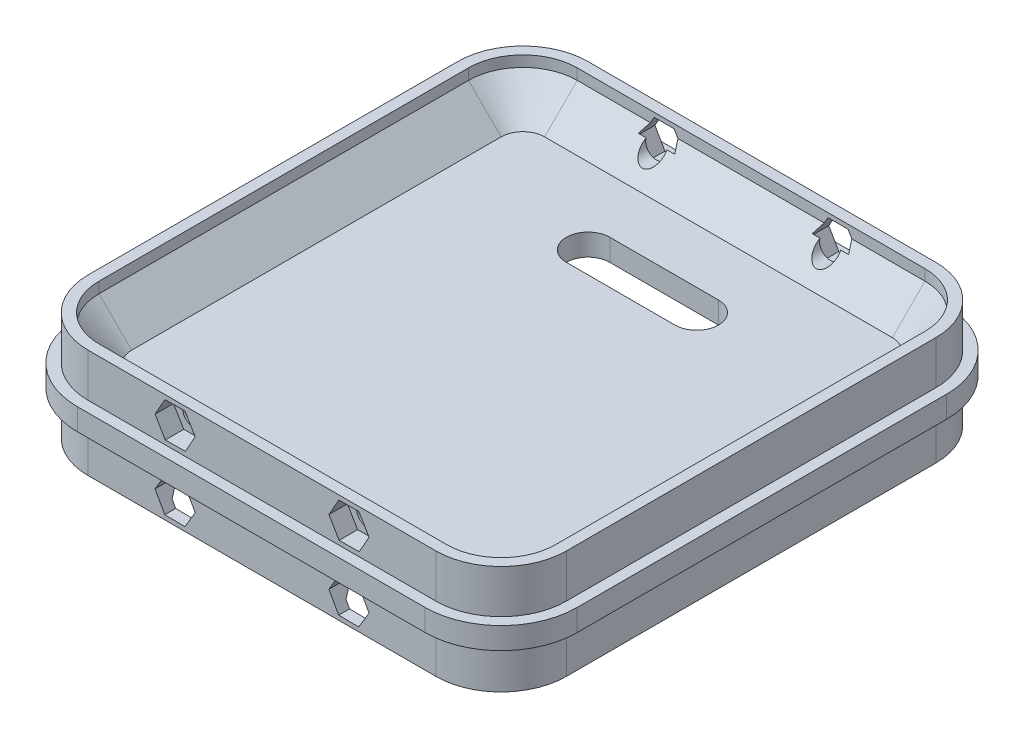
from build123d import *

# Parameters (mm, degrees)
BOSS_EXTRUDE1_DEPTH      = 30
BOSS_EXTRUDE1_DEPTH_BACK = 20
BOSS_EXTRUDE2_DEPTH      = 10
SKETCH2_R                = 5
CUT_EXTRUDE1_DEPTH       = 30
CUT_EXTRUDE3_START       = -30
SKETCH3_R                = 5
CUT_EXTRUDE3_DEPTH       = 30
CUT_EXTRUDE5_DEPTH       = 330.165611813
CUT_EXTRUDE7_DEPTH       = 20
CUT_EXTRUDE8_START       = -20
CUT_EXTRUDE8_DEPTH       = 20
CHAMFER7_SIZE            = 15
CUT_EXTRUDE6_DEPTH       = 8.5
SKETCH2_4_R              = 5
CUT_EXTRUDE2_DEPTH       = 8.5


with BuildPart() as part:
    # Sketch1 → Boss-Extrude1 (new, two sides: drawn at the far end of the back side and taken through both)
    with BuildSketch(Plane(origin=(0, 0, 0), x_dir=(1, 0, 0), z_dir=(0, 1, 0)).offset(-BOSS_EXTRUDE1_DEPTH_BACK)):
        with BuildLine():
            Line((30, 0), (190, 0))
            ThreePointArc((190, 0), (211.213203436, 8.786796564), (220, 30))
            Line((220, 30), (220, 200))
            ThreePointArc((220, 200), (211.213203436, 221.213203436), (190, 230))
            Line((190, 230), (30, 230))
            ThreePointArc((30, 230), (8.786796564, 221.213203436), (0, 200))
            Line((0, 200), (0, 30))
            ThreePointArc((0, 30), (8.786796564, 8.786796564), (30, 0))
        make_face()
    extrude(amount=BOSS_EXTRUDE1_DEPTH + BOSS_EXTRUDE1_DEPTH_BACK)

    # Sketch1<3> → Boss-Extrude2 (add)
    with BuildSketch(Plane(origin=(0, 0, 0), x_dir=(1, 0, 0), z_dir=(0, 1, 0))):
        with BuildLine():
            Line((-5, 30), (-5, 200))
            ThreePointArc((-5, 200), (5.251262658, 224.748737342), (30, 235))
            Line((30, 235), (190, 235))
            ThreePointArc((190, 235), (214.748737342, 224.748737342), (225, 200))
            Line((225, 200), (225, 30))
            ThreePointArc((225, 30), (214.748737342, 5.251262658), (190, -5))
            Line((190, -5), (30, -5))
            ThreePointArc((30, -5), (5.251262658, 5.251262658), (-5, 30))
        make_face()
        with BuildLine():
            Line((30, 0), (190, 0))
            ThreePointArc((190, 0), (211.213203436, 8.786796564), (220, 30))
            Line((220, 30), (220, 200))
            ThreePointArc((220, 200), (211.213203436, 221.213203436), (190, 230))
            Line((190, 230), (30, 230))
            ThreePointArc((30, 230), (8.786796564, 221.213203436), (0, 200))
            Line((0, 200), (0, 30))
            ThreePointArc((0, 30), (8.786796564, 8.786796564), (30, 0))
        make_face(mode=Mode.SUBTRACT)
    extrude(amount=BOSS_EXTRUDE2_DEPTH)

    # Sketch2 → Cut-Extrude1 (cut)
    with BuildSketch(Plane(origin=(0, 0, -230), x_dir=(-1, 0, 0), z_dir=(0, 0, -1))):
        with Locations((-150, 20)):
            Circle(SKETCH2_R)
        with Locations(Location((-70, 20, 0), (0, 0, 180))):
            Circle(SKETCH2_R)
        with Locations((-70, -10)):
            Circle(SKETCH2_R)
        with Locations(Location((-150, -10, 0), (0, 0, 180))):
            Circle(SKETCH2_R)
    extrude(amount=-CUT_EXTRUDE1_DEPTH, mode=Mode.SUBTRACT)

    # Sketch3 → Cut-Extrude3 (cut)
    with BuildSketch(Plane.XY.offset(CUT_EXTRUDE3_START)):
        with Locations((70, 20)):
            Circle(SKETCH3_R)
        with Locations(Location((150, 20, 0), (0, 0, 180))):
            Circle(SKETCH3_R)
        with Locations((150, -10)):
            Circle(SKETCH3_R)
        with Locations(Location((70, -10, 0), (0, 0, 180))):
            Circle(SKETCH3_R)
    extrude(amount=CUT_EXTRUDE3_DEPTH, mode=Mode.SUBTRACT)

    # Sketch4 → Cut-Extrude5 (cut, through all)
    with BuildSketch(Plane(origin=(0, 30, 0), x_dir=(1, 0, 0), z_dir=(0, 1, 0))):
        with BuildLine():
            Line((135, 165), (85, 165))
            ThreePointArc((85, 165), (75, 175), (85, 185))
            Line((85, 185), (135, 185))
            ThreePointArc((135, 185), (145, 175), (135, 165))
        make_face()
    extrude(amount=-CUT_EXTRUDE5_DEPTH, mode=Mode.SUBTRACT)

    # Sketch7 → Cut-Extrude7 (cut)
    with BuildSketch(Plane(origin=(0, 30, 0), x_dir=(1, 0, 0), z_dir=(0, 1, 0))):
        with BuildLine():
            Line((215, 30), (215, 200))
            ThreePointArc((215, 200), (207.67766953, 217.67766953), (190, 225))
            Line((190, 225), (30, 225))
            ThreePointArc((30, 225), (12.32233047, 217.67766953), (5, 200))
            Line((5, 200), (5, 30))
            ThreePointArc((5, 30), (12.32233047, 12.32233047), (30, 5))
            Line((30, 5), (190, 5))
            ThreePointArc((190, 5), (207.67766953, 12.32233047), (215, 30))
        make_face()
    extrude(amount=-CUT_EXTRUDE7_DEPTH, mode=Mode.SUBTRACT)

    # Sketch9 → Cut-Extrude8 (cut)
    with BuildSketch(Plane.XZ.offset(20).offset(CUT_EXTRUDE8_START)):
        with BuildLine():
            Line((190, -5), (30, -5))
            ThreePointArc((30, -5), (12.32233047, -12.32233047), (5, -30))
            Line((5, -30), (5, -200))
            ThreePointArc((5, -200), (12.32233047, -217.67766953), (30, -225))
            Line((30, -225), (190, -225))
            ThreePointArc((190, -225), (207.67766953, -217.67766953), (215, -200))
            Line((215, -200), (215, -30))
            ThreePointArc((215, -30), (207.67766953, -12.32233047), (190, -5))
        make_face()
    extrude(amount=CUT_EXTRUDE8_DEPTH, mode=Mode.SUBTRACT)

    # Chamfer7
    # the kernel refuses this chamfer: 15 mm, written as the material it adds along each edge
    with BuildSketch(Plane(origin=(190, 10, -225), x_dir=(0, 0.9996219169112968, -0.02749587661058586), z_dir=(-1, 0, 0))) as chamfer7_piece_1_section:
        Polygon((CHAMFER7_SIZE * 0.999621916911, -CHAMFER7_SIZE * 0.0274958766106), (-CHAMFER7_SIZE * 0.0274958766106, -CHAMFER7_SIZE * 0.999621916911), (0, 0), align=None)
    chamfer7_piece_1 = extrude(amount=160, mode=Mode.PRIVATE)
    chamfer7_piece_1 = chamfer7_piece_1 - Plane(origin=(150, 20, -219.960339284), x_dir=(-1, 0, 0), z_dir=(0, 0, -1)) * Cylinder(5, 380, mode=Mode.PRIVATE)
    chamfer7_piece_1 = chamfer7_piece_1 - Plane(origin=(70, 20, -219.960339284), x_dir=(1, 0, 0), z_dir=(0, 0, -1)) * Cylinder(5, 380, mode=Mode.PRIVATE)
    add(chamfer7_piece_1)
    with BuildSketch(Plane(origin=(30, 10, -5), x_dir=(0, 0.9996219169112968, 0.02749587661058638), z_dir=(1, 0, 0))) as chamfer7_piece_2_section:
        Polygon((CHAMFER7_SIZE * 0.999621916911, -CHAMFER7_SIZE * 0.0274958766106), (-CHAMFER7_SIZE * 0.0274958766106, -CHAMFER7_SIZE * 0.999621916911), (0, 0), align=None)
    chamfer7_piece_2 = extrude(amount=160, mode=Mode.PRIVATE)
    chamfer7_piece_2 = chamfer7_piece_2 - Plane(origin=(70, 20, -10.039660716), x_dir=(1, 0, 0), z_dir=(0, 0, -1)) * Cylinder(5, 380, mode=Mode.PRIVATE)
    chamfer7_piece_2 = chamfer7_piece_2 - Plane(origin=(150, 20, -10.039660716), x_dir=(-1, 0, 0), z_dir=(0, 0, -1)) * Cylinder(5, 380, mode=Mode.PRIVATE)
    add(chamfer7_piece_2)
    with BuildSketch(Plane(origin=(190, 10, -30), x_dir=(0, 0, 1), z_dir=(-1, 0, 0))) as chamfer7_piece_3:
        Polygon((25, CHAMFER7_SIZE), (25 - CHAMFER7_SIZE, 0), (25, 0), align=None)
    revolve(axis=Axis((190, 10, -30), (0, 1, 0)), revolution_arc=90)
    with BuildSketch(Plane(origin=(30, 10, -30), x_dir=(-1, 0, 0), z_dir=(0, 0, -1))) as chamfer7_piece_4:
        Polygon((25, CHAMFER7_SIZE), (25 - CHAMFER7_SIZE, 0), (25, 0), align=None)
    revolve(axis=Axis((30, 10, -30), (0, 1, 0)), revolution_arc=90)
    with BuildSketch(Plane(origin=(5, 10, -200), x_dir=(-0.02749587661058638, 0.9996219169112968, 0), z_dir=(0, 0, 1)), Plane(origin=(215, 10, -30), x_dir=(0.02749587661058586, 0.9996219169112968, 0), z_dir=(0, 0, -1))) as chamfer7_piece_5:
        Polygon((CHAMFER7_SIZE * 0.999621916911, -CHAMFER7_SIZE * 0.0274958766106), (-CHAMFER7_SIZE * 0.0274958766106, -CHAMFER7_SIZE * 0.999621916911), (0, 0), align=None)
    extrude(amount=170)
    with BuildSketch(Plane(origin=(30, 10, -200), x_dir=(0, 0, -1), z_dir=(1, 0, 0))) as chamfer7_piece_6:
        Polygon((25, CHAMFER7_SIZE), (25 - CHAMFER7_SIZE, 0), (25, 0), align=None)
    revolve(axis=Axis((30, 10, -200), (0, 1, 0)), revolution_arc=90)
    with BuildSketch(Plane(origin=(190, 10, -200), x_dir=(1, 0, 0), z_dir=(0, 0, 1))) as chamfer7_piece_7:
        Polygon((25, CHAMFER7_SIZE), (25 - CHAMFER7_SIZE, 0), (25, 0), align=None)
    revolve(axis=Axis((190, 10, -200), (0, 1, 0)), revolution_arc=90)
    with BuildSketch(Plane(origin=(30, 0, -225), x_dir=(0, 0.027495876610586382, 0.9996219169112968), z_dir=(1, 0, 0))) as chamfer7_piece_8_section:
        Polygon((CHAMFER7_SIZE * 0.999621916911, CHAMFER7_SIZE * 0.0274958766106), (-CHAMFER7_SIZE * 0.0274958766106, CHAMFER7_SIZE * 0.999621916911), (0, 0), align=None)
    chamfer7_piece_8 = extrude(amount=160, mode=Mode.PRIVATE)
    chamfer7_piece_8 = chamfer7_piece_8 - Plane(origin=(150, -10, -219.960344511), x_dir=(1, 0, 0), z_dir=(0, 0, -1)) * Cylinder(5, 380, mode=Mode.PRIVATE)
    chamfer7_piece_8 = chamfer7_piece_8 - Plane(origin=(70, -10, -219.960344511), x_dir=(-1, 0, 0), z_dir=(0, 0, -1)) * Cylinder(5, 380, mode=Mode.PRIVATE)
    add(chamfer7_piece_8)
    with BuildSketch(Plane(origin=(190, 0, -5), x_dir=(0, 0.02749587661058637, -0.9996219169112968), z_dir=(-1, 0, 0))) as chamfer7_piece_9_section:
        Polygon((CHAMFER7_SIZE * 0.999621916911, CHAMFER7_SIZE * 0.0274958766106), (-CHAMFER7_SIZE * 0.0274958766106, CHAMFER7_SIZE * 0.999621916911), (0, 0), align=None)
    chamfer7_piece_9 = extrude(amount=160, mode=Mode.PRIVATE)
    chamfer7_piece_9 = chamfer7_piece_9 - Plane(origin=(150, -10, -10.039655489), x_dir=(1, 0, 0), z_dir=(0, 0, -1)) * Cylinder(5, 380, mode=Mode.PRIVATE)
    chamfer7_piece_9 = chamfer7_piece_9 - Plane(origin=(70, -10, -10.039655489), x_dir=(-1, 0, 0), z_dir=(0, 0, -1)) * Cylinder(5, 380, mode=Mode.PRIVATE)
    add(chamfer7_piece_9)
    with BuildSketch(Plane(origin=(30, 0, -30), x_dir=(0, 0, 1), z_dir=(1, 0, 0))) as chamfer7_piece_10:
        Polygon((25 - CHAMFER7_SIZE, 0), (25, CHAMFER7_SIZE), (25, 0), align=None)
    revolve(axis=Axis((30, 0, -30), (0, -1, 0)), revolution_arc=90)
    with BuildSketch(Plane(origin=(190, 0, -30), x_dir=(1, 0, 0), z_dir=(0, 0, -1))) as chamfer7_piece_11:
        Polygon((25 - CHAMFER7_SIZE, 0), (25, CHAMFER7_SIZE), (25, 0), align=None)
    revolve(axis=Axis((190, 0, -30), (0, -1, 0)), revolution_arc=90)
    with BuildSketch(Plane(origin=(215, 0, -200), x_dir=(-0.9996219169112966, 0.02749587661058638, 0), z_dir=(0, 0, 1)), Plane(origin=(5, 0, -30), x_dir=(0.9996219169112966, 0.027495876610586358, 0), z_dir=(0, 0, -1))) as chamfer7_piece_12:
        Polygon((CHAMFER7_SIZE * 0.999621916911, CHAMFER7_SIZE * 0.0274958766106), (-CHAMFER7_SIZE * 0.0274958766106, CHAMFER7_SIZE * 0.999621916911), (0, 0), align=None)
    extrude(amount=170)
    with BuildSketch(Plane(origin=(190, 0, -200), x_dir=(0, 0, -1), z_dir=(-1, 0, 0))) as chamfer7_piece_13:
        Polygon((25 - CHAMFER7_SIZE, 0), (25, CHAMFER7_SIZE), (25, 0), align=None)
    revolve(axis=Axis((190, 0, -200), (0, -1, 0)), revolution_arc=90)
    with BuildSketch(Plane(origin=(30, 0, -200), x_dir=(-1, 0, 0), z_dir=(0, 0, 1))) as chamfer7_piece_14:
        Polygon((25 - CHAMFER7_SIZE, 0), (25, CHAMFER7_SIZE), (25, 0), align=None)
    revolve(axis=Axis((30, 0, -200), (0, -1, 0)), revolution_arc=90)

    # Sketch6 → Cut-Extrude6 (cut)
    with BuildSketch(Plane.XY):
        Polygon((140.762833455, 19.910069191), (145.459299093, 11.955413708), (154.696465638, 12.045344517), (159.237166545, 20.089930809), (154.540700907, 28.044586292), (145.303534362, 27.954655483), align=None)
        Polygon((65.285101729, 27.94374393), (60.76306682, 19.888650286), (65.477965091, 11.944906356), (74.714898271, 12.05625607), (79.23693318, 20.111349714), (74.522034909, 28.055093644), align=None)
        Polygon((140.763314396, -9.869721899), (145.268833053, -17.934065329), (154.505518657, -18.064343431), (159.236685604, -10.130278101), (154.731166947, -2.065934671), (145.494481343, -1.935656569), align=None)
        Polygon((60.763314396, -9.869721899), (65.268833053, -17.934065329), (74.505518657, -18.064343431), (79.236685604, -10.130278101), (74.731166947, -2.065934671), (65.494481343, -1.935656569), align=None)
    extrude(amount=-CUT_EXTRUDE6_DEPTH, mode=Mode.SUBTRACT)

    # Sketch2<4> → Cut-Extrude2 (cut)
    # profile 1 of 4: a face of its own
    with BuildSketch(Plane(origin=(0, 0, -230), x_dir=(-1, 0, 0), z_dir=(0, 0, -1))):
        Polygon((-74.618802154, 12), (-79.237604307, 20), (-74.618802154, 28), (-65.381197846, 28), (-60.762395693, 20), (-65.381197846, 12), align=None)
        with Locations((-70, 20)):
            Circle(SKETCH2_4_R, mode=Mode.SUBTRACT)
    # profile 2 of 4: a face of its own
    with BuildSketch(Plane(origin=(0, 0, -230), x_dir=(-1, 0, 0), z_dir=(0, 0, -1))):
        Polygon((-140.762395693, 20), (-145.381197846, 28), (-154.618802154, 28), (-159.237604307, 20), (-154.618802154, 12), (-145.381197846, 12), align=None)
        with Locations((-150, 20)):
            Circle(SKETCH2_4_R, mode=Mode.SUBTRACT)
    # profile 3 of 4: a face of its own
    with BuildSketch(Plane(origin=(0, 0, -230), x_dir=(-1, 0, 0), z_dir=(0, 0, -1))):
        Polygon((-65.381197846, -2), (-74.618802154, -2), (-79.237604307, -10), (-74.618802154, -18), (-65.381197846, -18), (-60.762395693, -10), align=None)
        with Locations((-70, -10)):
            Circle(SKETCH2_4_R, mode=Mode.SUBTRACT)
    # profile 4 of 4: a face of its own
    with BuildSketch(Plane(origin=(0, 0, -230), x_dir=(-1, 0, 0), z_dir=(0, 0, -1))):
        Polygon((-145.381197846, -2), (-140.762395693, -10), (-145.381197846, -18), (-154.618802154, -18), (-159.237604307, -10), (-154.618802154, -2), align=None)
        with Locations((-150, -10)):
            Circle(SKETCH2_4_R, mode=Mode.SUBTRACT)
    extrude(amount=-CUT_EXTRUDE2_DEPTH, mode=Mode.SUBTRACT)


solid = part.part
